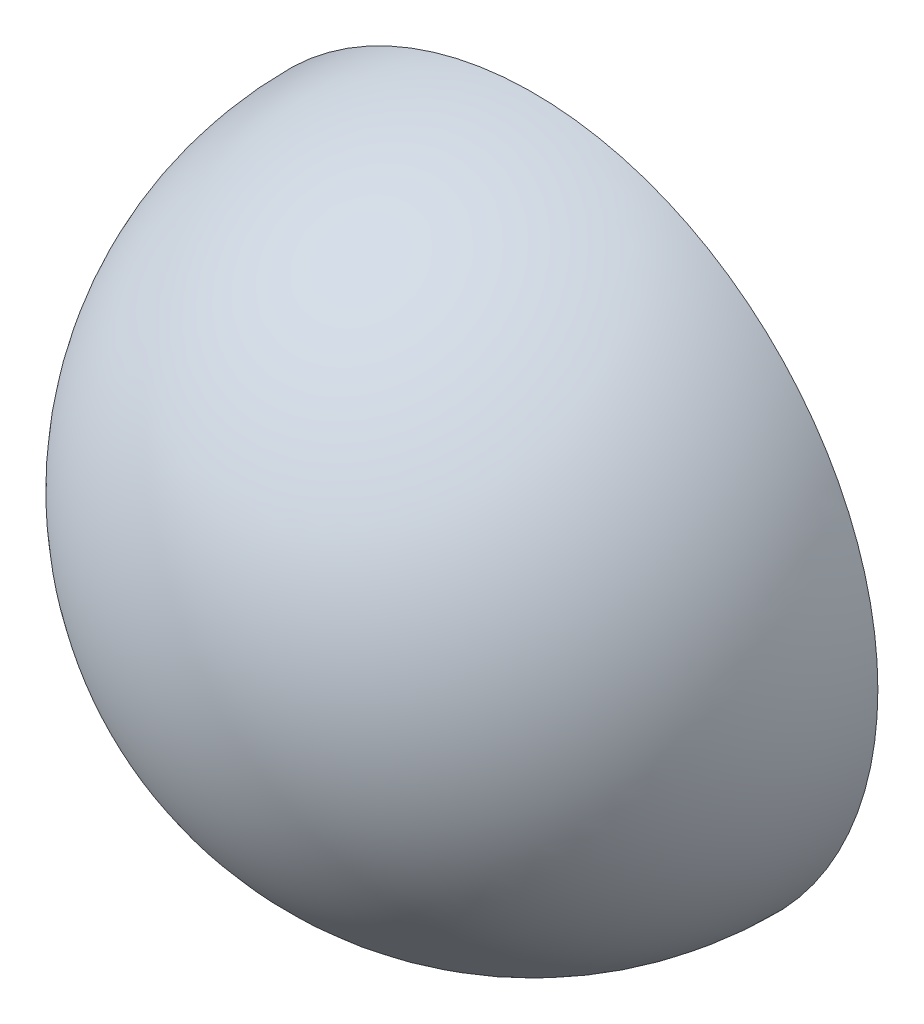
from build123d import *

# Parameters (mm, degrees)
REVOLVE_1_ANGLE = 180


with BuildPart() as part:
    # ｽｹｯﾁ1 → 回転1 (revolve)
    with BuildSketch(Plane.XY):
        with BuildLine():
            Line((-16.15, 0), (-14.65, 0))
            ThreePointArc((-14.65, 0), (0, -14.65), (14.65, 0))
            Line((14.65, 0), (16.15, 0))
            ThreePointArc((16.15, 0), (0, -16.15), (-16.15, 0))
        make_face()
    revolve(axis=Axis((14.65, 0, 0), (-1, 0, 0)), revolution_arc=REVOLVE_1_ANGLE)


solid = part.part
